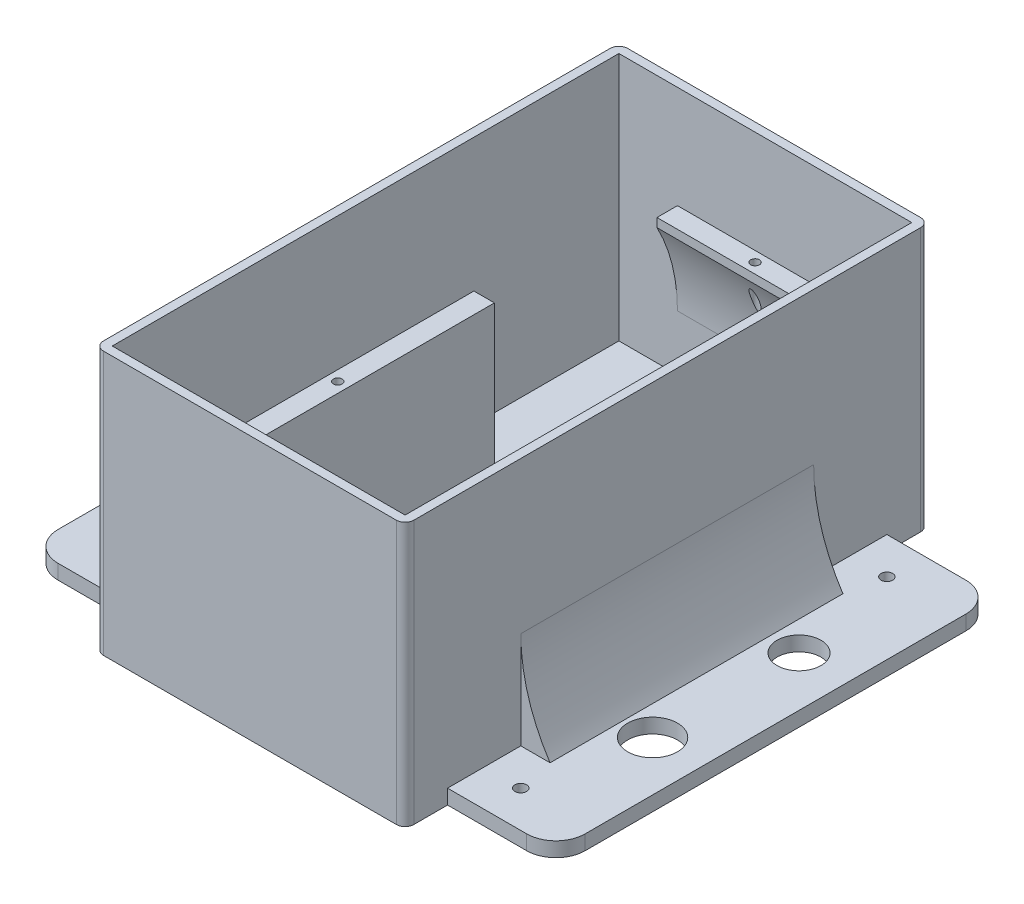
from build123d import *

# Parameters (mm, degrees)
CROQUIS1_W                    = 100
CROQUIS1_H                    = 173
CROQUIS1_R                    = 1.5
SALIENTE_EXTRUIR7_DEPTH       = 3
CROQUIS1_13_W                 = 100
CROQUIS1_13_H                 = 173
SALIENTE_EXTRUIR8_DEPTH       = 5
CROQUIS1_16_W                 = 106
CROQUIS1_16_H                 = 179
CROQUIS1_16_W_2               = 100
CROQUIS1_16_H_2               = 173
SALIENTE_EXTRUIR9_DEPTH       = 90
REDONDEO1_R                   = 3
CROQUIS4_W                    = 37
CROQUIS4_H                    = 150
CROQUIS4_R                    = 7.5
CROQUIS4_R_2                  = 8.5
SALIENTE_EXTRUIR10_DEPTH      = 5
SALIENTE_EXTRUIR11_DEPTH      = 50
SALIENTE_EXTRUIR11_DEPTH_BACK = 50
REDONDEO2_R                   = 10
CROQUIS1_17_R                 = 1.5
CROQUIS1_17_W                 = 7
CROQUIS1_17_H                 = 100
SALIENTE_EXTRUIR12_DEPTH      = 55
CROQUIS12_W                   = 60
CROQUIS12_H                   = 3
SALIENTE_EXTRUIR13_DEPTH      = 7
CROQUIS16_R                   = 1.5
CORTAR_EXTRUIR5_DEPTH         = 10
CROQUIS17_R                   = 2
CORTAR_EXTRUIR6_DEPTH         = 10
CROQUIS19_R                   = 3.5
CROQUIS19_R_2                 = 5
CORTAR_EXTRUIR7_DEPTH         = 10
REDONDEO3_R                   = 60
REDONDEO4_START               = -30
REDONDEO4_DEPTH               = 28.499998795
REDONDEO4_START_2             = 1.500002077
REDONDEO4_2_DEPTH             = 28.499997923
REDONDEO4_START_3             = -1.500001205
REDONDEO4_3_DEPTH             = 3.000003282
REDONDEO4_START_4             = 23.875277779
REDONDEO4_4_OUTLINE_R         = 1.5
REDONDEO4_4_DEPTH             = 28.124722221


with BuildPart() as part:
    # Croquis1 → Saliente-Extruir7 (new body)
    with BuildSketch(Plane(origin=(0, 0, 0), x_dir=(1, 0, 0), z_dir=(0, 1, 0))):
        Rectangle(CROQUIS1_W, CROQUIS1_H)
        with Locations(Location((-36, -23.5, 0), (0, 0, 270))):
            Circle(CROQUIS1_R, mode=Mode.SUBTRACT)
        with Locations(Location((36, -23.5, 0), (0, 0, 270))):
            Circle(CROQUIS1_R, mode=Mode.SUBTRACT)
    extrude(amount=SALIENTE_EXTRUIR7_DEPTH)

    # Croquis1<13> → Saliente-Extruir8 (add)
    with BuildSketch(Plane(origin=(0, 0, 0), x_dir=(1, 0, 0), z_dir=(0, 1, 0))):
        Rectangle(CROQUIS1_13_W, CROQUIS1_13_H)
    extrude(amount=SALIENTE_EXTRUIR8_DEPTH)

    # Croquis1<16> → Saliente-Extruir9 (add)
    with BuildSketch(Plane(origin=(0, 0, 0), x_dir=(1, 0, 0), z_dir=(0, 1, 0))):
        Rectangle(CROQUIS1_16_W, CROQUIS1_16_H)
        Rectangle(CROQUIS1_16_W_2, CROQUIS1_16_H_2, mode=Mode.SUBTRACT)
    extrude(amount=SALIENTE_EXTRUIR9_DEPTH)

    # Redondeo1
    redondeo1_edges = [part.edges().sort_by_distance(p)[0] for p in [
        (-53, 45, 89.5),
        (53, 45, 89.5),
        (53, 45, -89.5),
        (-53, 45, -89.5),
    ]]
    fillet(redondeo1_edges, radius=REDONDEO1_R)

    # Croquis4 → Saliente-Extruir10 (add)
    # profile 1 of 2: a face of its own
    with BuildSketch(Plane(origin=(0, 0, 0), x_dir=(1, 0, 0), z_dir=(0, 1, 0))):
        with Locations((-71.5, 0)):
            Rectangle(CROQUIS4_W, CROQUIS4_H)
    # profile 2 of 2: a face of its own
    with BuildSketch(Plane(origin=(0, 0, 0), x_dir=(1, 0, 0), z_dir=(0, 1, 0))):
        with Locations((71.5, 0)):
            Rectangle(CROQUIS4_W, CROQUIS4_H)
        with Locations(Location((73, 25, 0), (0, 0, 270))):
            Circle(CROQUIS4_R, mode=Mode.SUBTRACT)
        with Locations(Location((73, -25, 0), (0, 0, 270))):
            Circle(CROQUIS4_R_2, mode=Mode.SUBTRACT)
    extrude(amount=SALIENTE_EXTRUIR10_DEPTH)

    # Croquis5 → Saliente-Extruir11 (add, two sides: drawn at the far end of the back side and taken through both)
    with BuildSketch(Plane.XY.offset(-SALIENTE_EXTRUIR11_DEPTH_BACK)):
        Polygon((-53, 5), (-53, 20), (-63, 5), align=None)
        Polygon((53, 5), (53, 20), (63, 5), align=None)
    extrude(amount=SALIENTE_EXTRUIR11_DEPTH + SALIENTE_EXTRUIR11_DEPTH_BACK)

    # Redondeo2
    redondeo2_edges = [part.edges().sort_by_distance(p)[0] for p in [
        (90, 2.5, 75),
        (90, 2.5, -75),
        (-90, 2.5, -75),
        (-90, 2.5, 75),
    ]]
    fillet(redondeo2_edges, radius=REDONDEO2_R)

    # Croquis1<17> → Saliente-Extruir12 (add)
    # profile 1 of 2: a face of its own
    with BuildSketch(Plane(origin=(0, 0, 0), x_dir=(1, 0, 0), z_dir=(0, 1, 0))):
        Polygon((32.5, -73.5), (0, -73.5), (0, -75.5), (39.5, -75.5), (39.5, 26.5), (32.5, 26.5), align=None)
        with Locations(Location((36, -23.5, 0), (0, 0, 90))):
            Circle(CROQUIS1_17_R, mode=Mode.SUBTRACT)
    # profile 2 of 2: a face of its own
    with BuildSketch(Plane(origin=(0, 0, 0), x_dir=(1, 0, 0), z_dir=(0, 1, 0))):
        with Locations((-36, -23.5)):
            Rectangle(CROQUIS1_17_W, CROQUIS1_17_H)
        with Locations(Location((-36, -23.5, 0), (0, 0, 90))):
            Circle(CROQUIS1_17_R, mode=Mode.SUBTRACT)
    extrude(amount=SALIENTE_EXTRUIR12_DEPTH)

    # Croquis12 → Saliente-Extruir13 (add)
    with BuildSketch(Plane.XY.offset(-86.5)):
        with Locations((0, 53.5)):
            Rectangle(CROQUIS12_W, CROQUIS12_H)
    extrude(amount=SALIENTE_EXTRUIR13_DEPTH)

    # Croquis16 → Cortar-Extruir5 (cut)
    with BuildSketch(Plane(origin=(0, 55, 0), x_dir=(1, 0, 0), z_dir=(0, 1, 0))):
        with Locations(Location((0, 83, 0), (0, 0, 180))):
            Circle(CROQUIS16_R)
    extrude(amount=-CORTAR_EXTRUIR5_DEPTH, mode=Mode.SUBTRACT)

    # Croquis17 → Cortar-Extruir6 (cut)
    with BuildSketch(Plane(origin=(0, 5, 0), x_dir=(1, 0, 0), z_dir=(0, 1, 0))):
        with Locations(Location((-65.5, 62.5, 0), (0, 0, 270))):
            Circle(CROQUIS17_R)
        with Locations(Location((65.5, 62.5, 0), (0, 0, 270))):
            Circle(CROQUIS17_R)
        with Locations(Location((65.5, -62.5, 0), (0, 0, 270))):
            Circle(CROQUIS17_R)
        with Locations(Location((-65.5, -62.5, 0), (0, 0, 270))):
            Circle(CROQUIS17_R)
    extrude(amount=-CORTAR_EXTRUIR6_DEPTH, mode=Mode.SUBTRACT)

    # Croquis19 → Cortar-Extruir7 (cut)
    with BuildSketch(Plane(origin=(0, 5, 0), x_dir=(1, 0, 0), z_dir=(0, 1, 0))):
        with Locations(Location((-73, 25, 0), (0, 0, 270))):
            Circle(CROQUIS19_R)
        with Locations(Location((-71.5, -25, 0), (0, 0, 270))):
            Circle(CROQUIS19_R_2)
    extrude(amount=-CORTAR_EXTRUIR7_DEPTH, mode=Mode.SUBTRACT)

    # Redondeo3
    # the kernel refuses this fillet: 60 mm, written as the material it adds along each edge
    with BuildSketch(Plane(origin=(53, 20, 50), x_dir=(0, 1, 0), z_dir=(0, 0, -1)), Plane(origin=(-53, 20, -50), x_dir=(0, 1, 0), z_dir=(0, 0, 1))) as redondeo3_piece_1:
        with BuildLine():
            CenterArc((REDONDEO3_R * 0.302775637732, REDONDEO3_R), REDONDEO3_R, 236.309932474, 33.690067526)
            Line((-REDONDEO3_R * 0.251924558493, REDONDEO3_R * 0.167949705662), (0, 0))
            Line((0, 0), (REDONDEO3_R * 0.302775637732, 0))
        make_face()
    extrude(amount=100)

    # Redondeo4: read off the stored shape, not the designer's step
    # Redondeo4 outline → Redondeo4 (add)
    with BuildSketch(Plane.YZ.offset(REDONDEO4_START)):
        with BuildLine():
            ThreePointArc((52, -79.5), (38.366654525, -84.723706512), (23.875277779, -86.5))
            Line((23.875277779, -86.5), (52, -86.5))
            Line((52, -86.5), (52, -79.5))
        make_face()
    extrude(amount=REDONDEO4_DEPTH)

    # Redondeo4 2 outline → Redondeo4 2 (add)
    with BuildSketch(Plane.YZ.offset(REDONDEO4_START_2)):
        with BuildLine():
            ThreePointArc((52, -79.5), (38.366654525, -84.723706512), (23.875277779, -86.5))
            Line((23.875277779, -86.5), (52, -86.5))
            Line((52, -86.5), (52, -79.5))
        make_face()
    extrude(amount=REDONDEO4_2_DEPTH)

    # Redondeo4 3 outline → Redondeo4 3 (add)
    with BuildSketch(Plane.YZ.offset(REDONDEO4_START_3)):
        with BuildLine():
            ThreePointArc((52, -79.5), (38.366654525, -84.723706512), (23.875277779, -86.5))
            Line((23.875277779, -86.5), (52, -86.5))
            Line((52, -86.5), (52, -79.5))
        make_face()
    extrude(amount=REDONDEO4_3_DEPTH)

    # Redondeo4 4 outline → Redondeo4 4 (cut)
    with BuildSketch(Plane(origin=(0, 0, 0), x_dir=(1, 0, 0), z_dir=(0, 1, 0)).offset(REDONDEO4_START_4)):
        with Locations((0, 83)):
            Circle(REDONDEO4_4_OUTLINE_R)
    extrude(amount=REDONDEO4_4_DEPTH, mode=Mode.SUBTRACT)


solid = part.part
